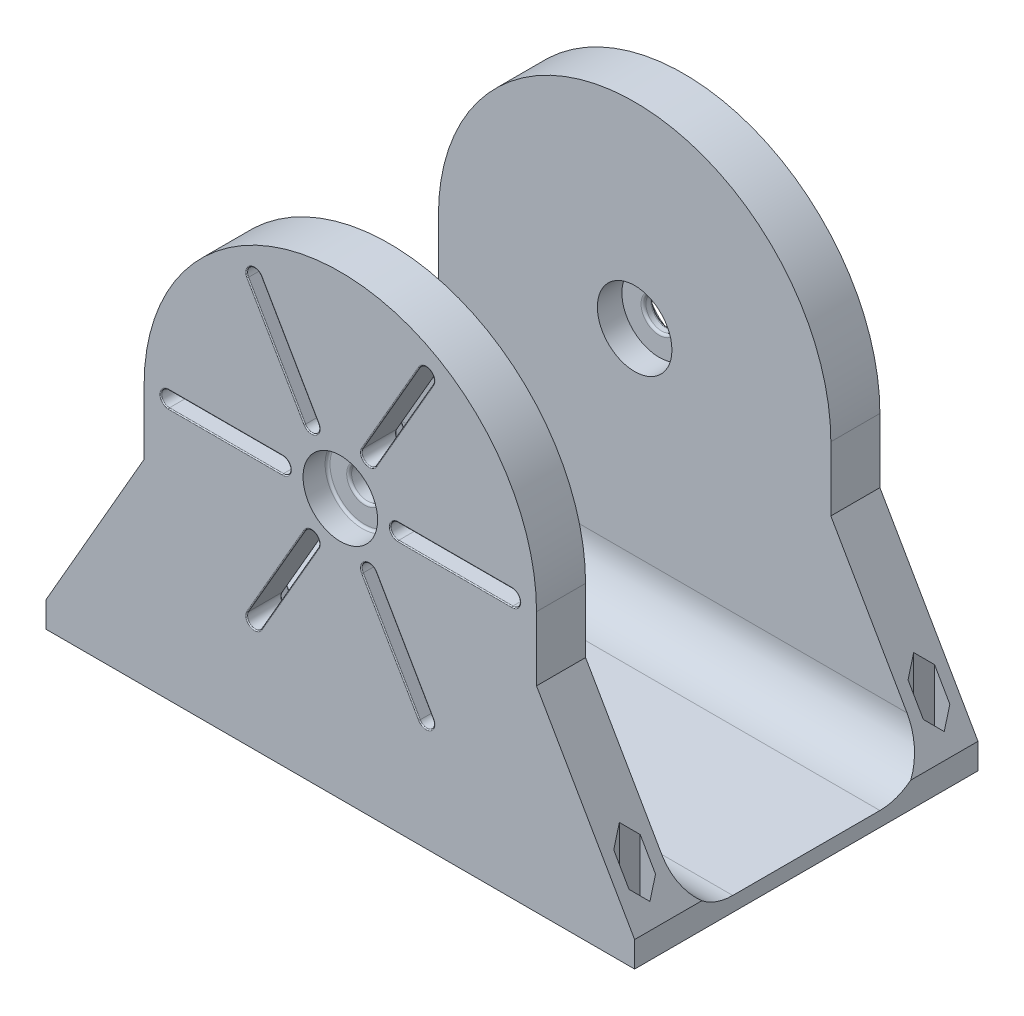
from build123d import *

# Parameters (mm, degrees)
BOSS_EXTRUDE1_START      = 25
BOSS_EXTRUDE1_DEPTH      = 10
BOSS_EXTRUDE2_START      = -25
BOSS_EXTRUDE2_DEPTH      = 10
BOSS_EXTRUDE3_DEPTH      = 25
BOSS_EXTRUDE3_DEPTH_BACK = 35
CUT_EXTRUDE1_DEPTH       = 90.518768982
CUT_EXTRUDE1_DEPTH_BACK  = 90.518768982
SKETCH4_R                = 3.2
CUT_EXTRUDE4_START       = 25
CUT_EXTRUDE4_DEPTH       = 2.8575
CUT_EXTRUDE5_START       = 27.8575
CUT_EXTRUDE5_DEPTH       = 7.1425
FILLET1_R                = 0.2
CIRPATTERN1_COUNT        = 6
FILLET1_OF_CIRPATTERN1_R = 0.2
CUT_EXTRUDE6_START       = 35
SKETCH8_R                = 7.6
CUT_EXTRUDE6_DEPTH       = 5
CUT_EXTRUDE7_START       = -25
SKETCH8_2_R              = 7.6
CUT_EXTRUDE7_DEPTH       = 5
BOSS_EXTRUDE4_DEPTH      = 5
SKETCH11_R               = 7.5
CUT_EXTRUDE8_DEPTH       = 3
CUT_EXTRUDE11_DEPTH      = 48.1
CUT_EXTRUDE12_REACH      = 93.589
SKETCH13_R               = 1.4
CUT_EXTRUDE13_DEPTH      = 92.589355277
CUT_EXTRUDE13_DEPTH_BACK = 92.589355277
FILLET2_R                = 0.5
FILLET3_R                = 10


with BuildPart() as part:
    # Sketch1 → Boss-Extrude1 (new body)
    with BuildSketch(Plane.XY.offset(BOSS_EXTRUDE1_START)):
        with BuildLine():
            Line((40, -13.1), (63, -53.1))
            Line((63, -53.1), (40, -53.1))
            Line((40, -53.1), (-40, -53.1))
            Line((-40, -53.1), (-63, -53.1))
            Line((-63, -53.1), (-40, -13.1))
            Line((-40, -13.1), (-40, 0))
            ThreePointArc((-40, 0), (0, 40), (40, 0))
            Line((40, 0), (40, -13.1))
        make_face()
    extrude(amount=BOSS_EXTRUDE1_DEPTH)



with BuildPart() as body_2:
    # Sketch1<2> → Boss-Extrude2 (new body)
    with BuildSketch(Plane.XY.offset(BOSS_EXTRUDE2_START)):
        with BuildLine():
            Line((40, -13.1), (63, -53.1))
            Line((63, -53.1), (40, -53.1))
            Line((40, -53.1), (-40, -53.1))
            Line((-40, -53.1), (-63, -53.1))
            Line((-63, -53.1), (-40, -13.1))
            Line((-40, -13.1), (-40, 0))
            ThreePointArc((-40, 0), (0, 40), (40, 0))
            Line((40, 0), (40, -13.1))
        make_face()
    extrude(amount=-BOSS_EXTRUDE2_DEPTH)


with BuildPart() as part_1:
    add(part.part)

    add(body_2.part)  # Boss-Extrude3 merges body 2
    # Sketch2 → Boss-Extrude3 (add, two sides: drawn at the far end of the back side and taken through both)
    with BuildSketch(Plane.XY.offset(-BOSS_EXTRUDE3_DEPTH_BACK)):
        Polygon((-63, -53.1), (63, -53.1), (61.275, -50.1), (-61.275, -50.1), align=None)
    extrude(amount=BOSS_EXTRUDE3_DEPTH + BOSS_EXTRUDE3_DEPTH_BACK)

    # Sketch4 → Cut-Extrude1 (cut, two sides: drawn at the far end of the back side and taken through both)
    with BuildSketch(Plane.XY.offset(-CUT_EXTRUDE1_DEPTH_BACK)):
        Circle(SKETCH4_R)
    extrude(amount=CUT_EXTRUDE1_DEPTH + CUT_EXTRUDE1_DEPTH_BACK, mode=Mode.SUBTRACT)

    # Sketch5 → Cut-Extrude4 (cut)
    with BuildSketch(Plane.XY.offset(CUT_EXTRUDE4_START)):
        Polygon((-33.239081679, 3.05), (-10, 3.05), (-8.239081679, 0), (-10, -3.05), (-33.239081679, -3.05), (-36.760918321, -3.05), (-38.521836642, 0), (-36.760918321, 3.05), align=None)
    cut_extrude4 = extrude(amount=CUT_EXTRUDE4_DEPTH, mode=Mode.SUBTRACT)

    # Sketch6 → Cut-Extrude5 (cut)
    with BuildSketch(Plane.XY.offset(CUT_EXTRUDE5_START)):
        with BuildLine():
            Line((-35, 1.5875), (-11.760918321, 1.5875))
            ThreePointArc((-11.760918321, 1.5875), (-10.173418321, 0), (-11.760918321, -1.5875))
            Line((-11.760918321, -1.5875), (-35, -1.5875))
            ThreePointArc((-35, -1.5875), (-36.5875, 0), (-35, 1.5875))
        make_face()
    cut_extrude5 = extrude(amount=CUT_EXTRUDE5_DEPTH, mode=Mode.SUBTRACT)

    # Fillet1
    fillet1_edges = [part_1.edges().sort_by_distance(p)[0] for p in [
        (-9.119540839, -1.525, 27.8575),
        (-10, -3.05, 26.42875),
        (-9.119540839, 1.525, 27.8575),
        (-8.239081679, 0, 26.42875),
        (-23.380459161, 3.05, 27.8575),
        (-10, 3.05, 26.42875),
        (-37.641377482, 1.525, 27.8575),
        (-36.760918321, 3.05, 26.42875),
        (-37.641377482, -1.525, 27.8575),
        (-38.521836642, 0, 26.42875),
        (-23.380459161, -3.05, 27.8575),
        (-36.760918321, -3.05, 26.42875),
        (-9.119540839, -1.525, 25),
        (-23.380459161, -3.05, 25),
        (-37.641377482, -1.525, 25),
        (-37.641377482, 1.525, 25),
        (-23.380459161, 3.05, 25),
        (-9.119540839, 1.525, 25),
        (-23.380459161, 1.5875, 35),
        (-23.380459161, 1.5875, 27.8575),
        (-23.380459161, -1.5875, 35),
        (-23.380459161, -1.5875, 27.8575),
        (-10.173418321, 0, 27.8575),
        (-36.5875, 0, 27.8575),
        (-10.173418321, 0, 35),
        (-36.5875, 0, 35),
    ]]
    fillet(fillet1_edges, radius=FILLET1_R)

    # CirPattern1: Cut-Extrude4, Cut-Extrude5 ×6 about axis
    cirpattern1_axis = Axis((0, 0, 0), (0, 0, 1))
    add([cut_extrude4.rotate(cirpattern1_axis, i * 360 / CIRPATTERN1_COUNT) for i in range(1, CIRPATTERN1_COUNT)], mode=Mode.SUBTRACT)
    add([cut_extrude5.rotate(cirpattern1_axis, i * 360 / CIRPATTERN1_COUNT) for i in range(1, CIRPATTERN1_COUNT)], mode=Mode.SUBTRACT)

    # Fillet1 of CirPattern1
    fillet1_of_cirpattern1_edges = [part_1.edges().sort_by_distance(p)[0] for p in [
        (-3.239081679, -8.660254038, 27.8575),
        (-2.358622518, -10.185254038, 26.42875),
        (-5.880459161, -7.135254038, 27.8575),
        (-4.119540839, -7.135254038, 26.42875),
        (-14.331607062, -18.723071585, 27.8575),
        (-7.641377482, -7.135254038, 26.42875),
        (-20.141377482, -31.835889132, 27.8575),
        (-21.021836642, -30.310889132, 26.42875),
        (-17.5, -33.360889132, 27.8575),
        (-19.260918321, -33.360889132, 26.42875),
        (-9.048852099, -21.773071585, 27.8575),
        (-15.739081679, -33.360889132, 26.42875),
        (-3.239081679, -8.660254038, 25),
        (-9.048852099, -21.773071585, 25),
        (-17.5, -33.360889132, 25),
        (-20.141377482, -31.835889132, 25),
        (-14.331607062, -18.723071585, 25),
        (-5.880459161, -7.135254038, 25),
        (-13.065044909, -19.454321585, 35),
        (-13.065044909, -19.454321585, 27.8575),
        (-10.315414252, -21.041821585, 35),
        (-10.315414252, -21.041821585, 27.8575),
        (-5.086709161, -8.810438709, 27.8575),
        (-18.29375, -31.685704461, 27.8575),
        (-5.086709161, -8.810438709, 35),
        (-18.29375, -31.685704461, 35),
        (5.880459161, -7.135254038, 27.8575),
        (7.641377482, -7.135254038, 26.42875),
        (3.239081679, -8.660254038, 27.8575),
        (4.119540839, -7.135254038, 26.42875),
        (9.048852099, -21.773071585, 27.8575),
        (2.358622518, -10.185254038, 26.42875),
        (17.5, -33.360889132, 27.8575),
        (15.739081679, -33.360889132, 26.42875),
        (20.141377482, -31.835889132, 27.8575),
        (19.260918321, -33.360889132, 26.42875),
        (14.331607062, -18.723071585, 27.8575),
        (21.021836642, -30.310889132, 26.42875),
        (5.880459161, -7.135254038, 25),
        (14.331607062, -18.723071585, 25),
        (20.141377482, -31.835889132, 25),
        (17.5, -33.360889132, 25),
        (9.048852099, -21.773071585, 25),
        (3.239081679, -8.660254038, 25),
        (10.315414252, -21.041821585, 35),
        (10.315414252, -21.041821585, 27.8575),
        (13.065044909, -19.454321585, 35),
        (13.065044909, -19.454321585, 27.8575),
        (5.086709161, -8.810438709, 27.8575),
        (18.29375, -31.685704461, 27.8575),
        (5.086709161, -8.810438709, 35),
        (18.29375, -31.685704461, 35),
        (9.119540839, 1.525, 27.8575),
        (10, 3.05, 26.42875),
        (9.119540839, -1.525, 27.8575),
        (8.239081679, 0, 26.42875),
        (23.380459161, -3.05, 27.8575),
        (10, -3.05, 26.42875),
        (37.641377482, -1.525, 27.8575),
        (36.760918321, -3.05, 26.42875),
        (37.641377482, 1.525, 27.8575),
        (38.521836642, 0, 26.42875),
        (23.380459161, 3.05, 27.8575),
        (36.760918321, 3.05, 26.42875),
        (9.119540839, 1.525, 25),
        (23.380459161, 3.05, 25),
        (37.641377482, 1.525, 25),
        (37.641377482, -1.525, 25),
        (23.380459161, -3.05, 25),
        (9.119540839, -1.525, 25),
        (23.380459161, -1.5875, 35),
        (23.380459161, -1.5875, 27.8575),
        (23.380459161, 1.5875, 35),
        (23.380459161, 1.5875, 27.8575),
        (10.173418321, 0, 27.8575),
        (36.5875, 0, 27.8575),
        (10.173418321, 0, 35),
        (36.5875, 0, 35),
        (3.239081679, 8.660254038, 27.8575),
        (2.358622518, 10.185254038, 26.42875),
        (5.880459161, 7.135254038, 27.8575),
        (4.119540839, 7.135254038, 26.42875),
        (14.331607062, 18.723071585, 27.8575),
        (7.641377482, 7.135254038, 26.42875),
        (20.141377482, 31.835889132, 27.8575),
        (21.021836642, 30.310889132, 26.42875),
        (17.5, 33.360889132, 27.8575),
        (19.260918321, 33.360889132, 26.42875),
        (9.048852099, 21.773071585, 27.8575),
        (15.739081679, 33.360889132, 26.42875),
        (3.239081679, 8.660254038, 25),
        (9.048852099, 21.773071585, 25),
        (17.5, 33.360889132, 25),
        (20.141377482, 31.835889132, 25),
        (14.331607062, 18.723071585, 25),
        (5.880459161, 7.135254038, 25),
        (13.065044909, 19.454321585, 35),
        (13.065044909, 19.454321585, 27.8575),
        (10.315414252, 21.041821585, 35),
        (10.315414252, 21.041821585, 27.8575),
        (5.086709161, 8.810438709, 27.8575),
        (18.29375, 31.685704461, 27.8575),
        (5.086709161, 8.810438709, 35),
        (18.29375, 31.685704461, 35),
        (-5.880459161, 7.135254038, 27.8575),
        (-7.641377482, 7.135254038, 26.42875),
        (-3.239081679, 8.660254038, 27.8575),
        (-4.119540839, 7.135254038, 26.42875),
        (-9.048852099, 21.773071585, 27.8575),
        (-2.358622518, 10.185254038, 26.42875),
        (-17.5, 33.360889132, 27.8575),
        (-15.739081679, 33.360889132, 26.42875),
        (-20.141377482, 31.835889132, 27.8575),
        (-19.260918321, 33.360889132, 26.42875),
        (-14.331607062, 18.723071585, 27.8575),
        (-21.021836642, 30.310889132, 26.42875),
        (-5.880459161, 7.135254038, 25),
        (-14.331607062, 18.723071585, 25),
        (-20.141377482, 31.835889132, 25),
        (-17.5, 33.360889132, 25),
        (-9.048852099, 21.773071585, 25),
        (-3.239081679, 8.660254038, 25),
        (-10.315414252, 21.041821585, 35),
        (-10.315414252, 21.041821585, 27.8575),
        (-13.065044909, 19.454321585, 35),
        (-13.065044909, 19.454321585, 27.8575),
        (-5.086709161, 8.810438709, 27.8575),
        (-18.29375, 31.685704461, 27.8575),
        (-5.086709161, 8.810438709, 35),
        (-18.29375, 31.685704461, 35),
    ]]
    fillet(fillet1_of_cirpattern1_edges, radius=FILLET1_OF_CIRPATTERN1_R)

    # Sketch8 → Cut-Extrude6 (cut)
    with BuildSketch(Plane.XY.offset(CUT_EXTRUDE6_START)):
        Circle(SKETCH8_R)
    extrude(amount=-CUT_EXTRUDE6_DEPTH, mode=Mode.SUBTRACT)

    # Sketch8<2> → Cut-Extrude7 (cut)
    with BuildSketch(Plane.XY.offset(CUT_EXTRUDE7_START)):
        Circle(SKETCH8_2_R)
    extrude(amount=-CUT_EXTRUDE7_DEPTH, mode=Mode.SUBTRACT)

    # Sketch10 → Boss-Extrude4 (add)
    with BuildSketch(Plane(origin=(0, 0, -35), x_dir=(-1, 0, 0), z_dir=(0, 0, -1))):
        with BuildLine():
            Line((-17.395287132, -6.571810208), (-17.395287132, 15.307157848))
            Line((-17.395287132, 15.307157848), (-15.311099774, 17.296395792))
            Line((-15.311099774, 17.296395792), (-12.46185448, 19.451424939))
            Line((-12.46185448, 19.451424939), (-10.63935497, 20.5))
            Line((-10.63935497, 20.5), (10.639354967, 20.5))
            Line((10.639354967, 20.5), (12.481546734, 19.440095002))
            Line((12.481546734, 19.440095002), (15.334663563, 17.215949154))
            Line((15.334663563, 17.215949154), (17.351649475, 15.287999429))
            Line((17.351649475, 15.287999429), (17.351649475, -6.686177108))
            ThreePointArc((17.351649475, -6.686177108), (-0.061204642, -18.595186415), (-17.395287132, -6.571810208))
        make_face()
        with BuildLine():
            Line((-14.395287132, -5.999057373), (-14.395287132, 14.02336094))
            Line((-14.395287132, 14.02336094), (-13.364210648, 15.007464628))
            Line((-13.364210648, 15.007464628), (-10.802429685, 16.945069879))
            Line((-10.802429685, 16.945069879), (-9.202356052, 17.865672216))
            Line((-9.202356052, 17.865672216), (-5.025287127, 17.865672216))
            Line((-5.025287127, 17.865672216), (-5.025287127, 18.307908255))
            ThreePointArc((-5.025287127, 18.307908255), (-4.850962964, 18.728764013), (-4.430107206, 18.903088176))
            Line((-4.430107206, 18.903088176), (6.970107208, 18.903088176))
            ThreePointArc((6.970107208, 18.903088176), (7.390962965, 18.728764013), (7.565287128, 18.307908255))
            Line((7.565287128, 18.307908255), (7.565287128, 17.865672216))
            Line((7.565287128, 17.865672216), (9.202356049, 17.865672216))
            Line((9.202356049, 17.865672216), (10.803064919, 16.944704398))
            Line((10.803064919, 16.944704398), (13.37101734, 14.942858327))
            Line((13.37101734, 14.942858327), (14.351649475, 14.00551442))
            Line((14.351649475, 14.00551442), (14.351649475, -6.102715652))
            ThreePointArc((14.351649475, -6.102715652), (-0.056234518, -15.595185752), (-14.395287132, -5.999057373))
        make_face(mode=Mode.SUBTRACT)
    extrude(amount=BOSS_EXTRUDE4_DEPTH)

    # Sketch11 → Cut-Extrude8 (cut)
    with BuildSketch(Plane(origin=(0, 0, -35), x_dir=(-1, 0, 0), z_dir=(0, 0, -1))):
        Circle(SKETCH11_R)
    extrude(amount=-CUT_EXTRUDE8_DEPTH, mode=Mode.SUBTRACT)

    # Sketch12 → Cut-Extrude11 (cut)
    with BuildSketch(Plane(origin=(0, 0, 0), x_dir=(1, 0, 0), z_dir=(0, 1, 0))):
        Polygon((-51.882308546, 30), (-53.441154273, 32.7), (-56.558845727, 32.7), (-58.117691454, 30), (-56.558845727, 27.3), (-53.441154273, 27.3), align=None)
        Polygon((58.117691454, 30), (56.558845727, 32.7), (53.441154273, 32.7), (51.882308546, 30), (53.441154273, 27.3), (56.558845727, 27.3), align=None)
        Polygon((56.558845727, -32.7), (58.117691454, -30), (56.558845727, -27.3), (53.441154273, -27.3), (51.882308546, -30), (53.441154273, -32.7), align=None)
        Polygon((-51.882308546, -30), (-53.441154273, -27.3), (-56.558845727, -27.3), (-58.117691454, -30), (-56.558845727, -32.7), (-53.441154273, -32.7), align=None)
    extrude(amount=-CUT_EXTRUDE11_DEPTH, mode=Mode.SUBTRACT)

    # Sketch13 → Cut-Extrude12 (cut, up to next)
    with BuildSketch(Plane(origin=(0, 0, 0), x_dir=(1, 0, 0), z_dir=(0, 1, 0)), mode=Mode.PRIVATE) as cut_extrude12_sk1:
        with Locations(Location((-55, 30, 0), (0, 0, 180))):
            Circle(SKETCH13_R)
    cut_extrude12_tool1 = extrude(cut_extrude12_sk1.sketch, amount=-CUT_EXTRUDE12_REACH, mode=Mode.PRIVATE) & part_1.part
    # Sketch13 → Cut-Extrude12 (cut, up to next)
    with BuildSketch(Plane(origin=(0, 0, 0), x_dir=(1, 0, 0), z_dir=(0, 1, 0)), mode=Mode.PRIVATE) as cut_extrude12_sk2:
        with Locations(Location((55, 30, 0), (0, 0, 180))):
            Circle(SKETCH13_R)
    cut_extrude12_tool2 = extrude(cut_extrude12_sk2.sketch, amount=-CUT_EXTRUDE12_REACH, mode=Mode.PRIVATE) & part_1.part
    # Sketch13 → Cut-Extrude12 (cut, up to next)
    with BuildSketch(Plane(origin=(0, 0, 0), x_dir=(1, 0, 0), z_dir=(0, 1, 0)), mode=Mode.PRIVATE) as cut_extrude12_sk3:
        with Locations(Location((55, -30, 0), (0, 0, 180))):
            Circle(SKETCH13_R)
    cut_extrude12_tool3 = extrude(cut_extrude12_sk3.sketch, amount=-CUT_EXTRUDE12_REACH, mode=Mode.PRIVATE) & part_1.part
    # Sketch13 → Cut-Extrude12 (cut, up to next)
    with BuildSketch(Plane(origin=(0, 0, 0), x_dir=(1, 0, 0), z_dir=(0, 1, 0)), mode=Mode.PRIVATE) as cut_extrude12_sk4:
        with Locations(Location((-55, -30, 0), (0, 0, 180))):
            Circle(SKETCH13_R)
    cut_extrude12_tool4 = extrude(cut_extrude12_sk4.sketch, amount=-CUT_EXTRUDE12_REACH, mode=Mode.PRIVATE) & part_1.part
    add(cut_extrude12_tool1.solids().sort_by_distance((-55, 0, -30))[0], mode=Mode.SUBTRACT)
    add(cut_extrude12_tool2.solids().sort_by_distance((55, 0, -30))[0], mode=Mode.SUBTRACT)
    add(cut_extrude12_tool3.solids().sort_by_distance((55, 0, 30))[0], mode=Mode.SUBTRACT)
    add(cut_extrude12_tool4.solids().sort_by_distance((-55, 0, 30))[0], mode=Mode.SUBTRACT)

    # Sketch14 → Cut-Extrude13 (cut, two sides: drawn at the far end of the back side and taken through both)
    with BuildSketch(Plane.XY.offset(-CUT_EXTRUDE13_DEPTH_BACK)):
        Polygon((-63, -53.1), (-60, -47.882608696), (-60, -53.1), align=None)
        Polygon((60, -47.882608696), (60, -53.1), (63, -53.1), align=None)
    extrude(amount=CUT_EXTRUDE13_DEPTH + CUT_EXTRUDE13_DEPTH_BACK, mode=Mode.SUBTRACT)

    # Fillet2
    fillet2_edges = [part_1.edges().sort_by_distance(p)[0] for p in [
        (-3.2, 0, 25),
        (-7.6, 0, 30),
        (-3.2, 0, 30),
        (-3.2, 0, -30),
        (7.5, 0, -32),
        (-3.2, 0, -32),
    ]]
    fillet(fillet2_edges, radius=FILLET2_R)

    # Fillet3
    fillet3_edges = [part_1.edges().sort_by_distance(p)[0] for p in [
        (0, -50.1, 25),
        (0, -50.1, -25),
    ]]
    fillet(fillet3_edges, radius=FILLET3_R)


solid = part_1.part
